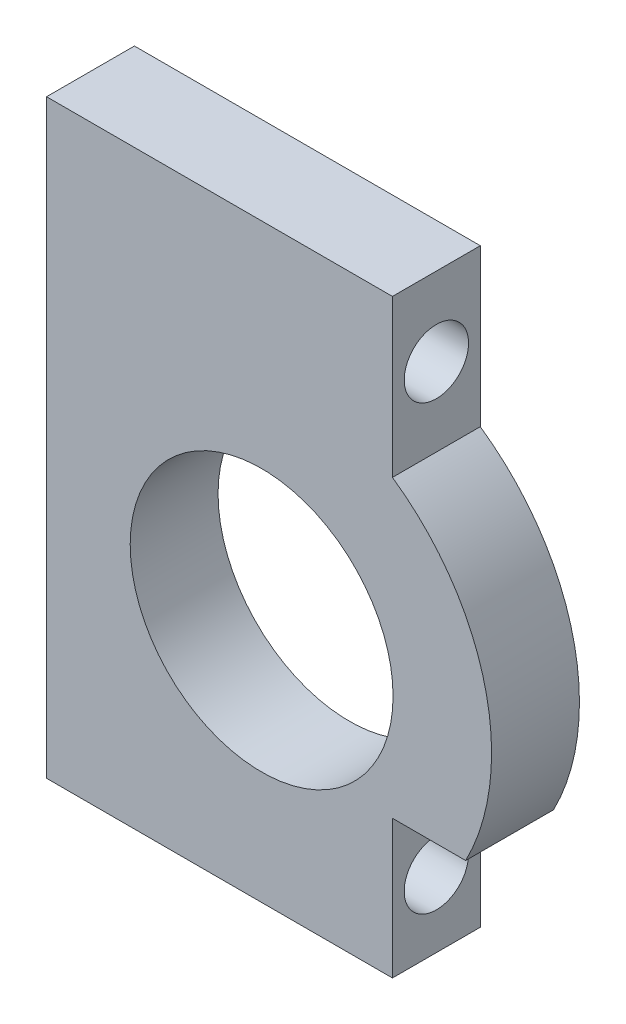
from build123d import *

# Parameters (mm, degrees)
BOSS_EXTRUDE1_DEPTH      = 3.175
BOSS_EXTRUDE1_DEPTH_BACK = 3.175
SKETCH2_R                = 9.5
CUT_EXTRUDE1_REACH       = 86.824
SKETCH3_R                = 2.325


with BuildPart() as part:
    # Sketch2 → Boss-Extrude1 (new, two sides: drawn at the far end of the back side and taken through both)
    with BuildSketch(Plane(origin=(0, 0, -13.2), x_dir=(-1, 0, 0), z_dir=(0, 0, -1)).offset(-BOSS_EXTRUDE1_DEPTH_BACK)):
        with BuildLine():
            Line((-19.1, 36.72), (-44.1, 36.72))
            Line((-44.1, 36.72), (-44.1, 46.72))
            Line((-44.1, 46.72), (-49.39334567, 46.72))
            ThreePointArc((-49.39334567, 46.72), (-50.77714312, 58.387484646), (-44.1, 68.055))
            Line((-44.1, 68.055), (-44.1, 79.385))
            Line((-44.1, 79.385), (-19.1, 79.385))
            Line((-19.1, 79.385), (-19.1, 36.72))
        make_face()
        with Locations((-34.645, 54.385)):
            Circle(SKETCH2_R, mode=Mode.SUBTRACT)
    extrude(amount=BOSS_EXTRUDE1_DEPTH + BOSS_EXTRUDE1_DEPTH_BACK)

    # Sketch3 → Cut-Extrude1 (cut, up to next)
    with BuildSketch(Plane(origin=(44.1, 0, 0), x_dir=(0, 0, -1), z_dir=(1, 0, 0)), mode=Mode.PRIVATE) as cut_extrude1_sk1:
        with Locations((13.2, 41.72)):
            Circle(SKETCH3_R)
    cut_extrude1_tool1 = extrude(cut_extrude1_sk1.sketch, amount=-CUT_EXTRUDE1_REACH, mode=Mode.PRIVATE) & part.part
    # Sketch3 → Cut-Extrude1 (cut, up to next)
    with BuildSketch(Plane(origin=(44.1, 0, 0), x_dir=(0, 0, -1), z_dir=(1, 0, 0)), mode=Mode.PRIVATE) as cut_extrude1_sk2:
        with Locations((13.2, 73.72)):
            Circle(SKETCH3_R)
    cut_extrude1_tool2 = extrude(cut_extrude1_sk2.sketch, amount=-CUT_EXTRUDE1_REACH, mode=Mode.PRIVATE) & part.part
    add(cut_extrude1_tool1.solids().sort_by_distance((44.1, 41.72, -13.2))[0], mode=Mode.SUBTRACT)
    add(cut_extrude1_tool2.solids().sort_by_distance((44.1, 73.72, -13.2))[0], mode=Mode.SUBTRACT)


solid = part.part
